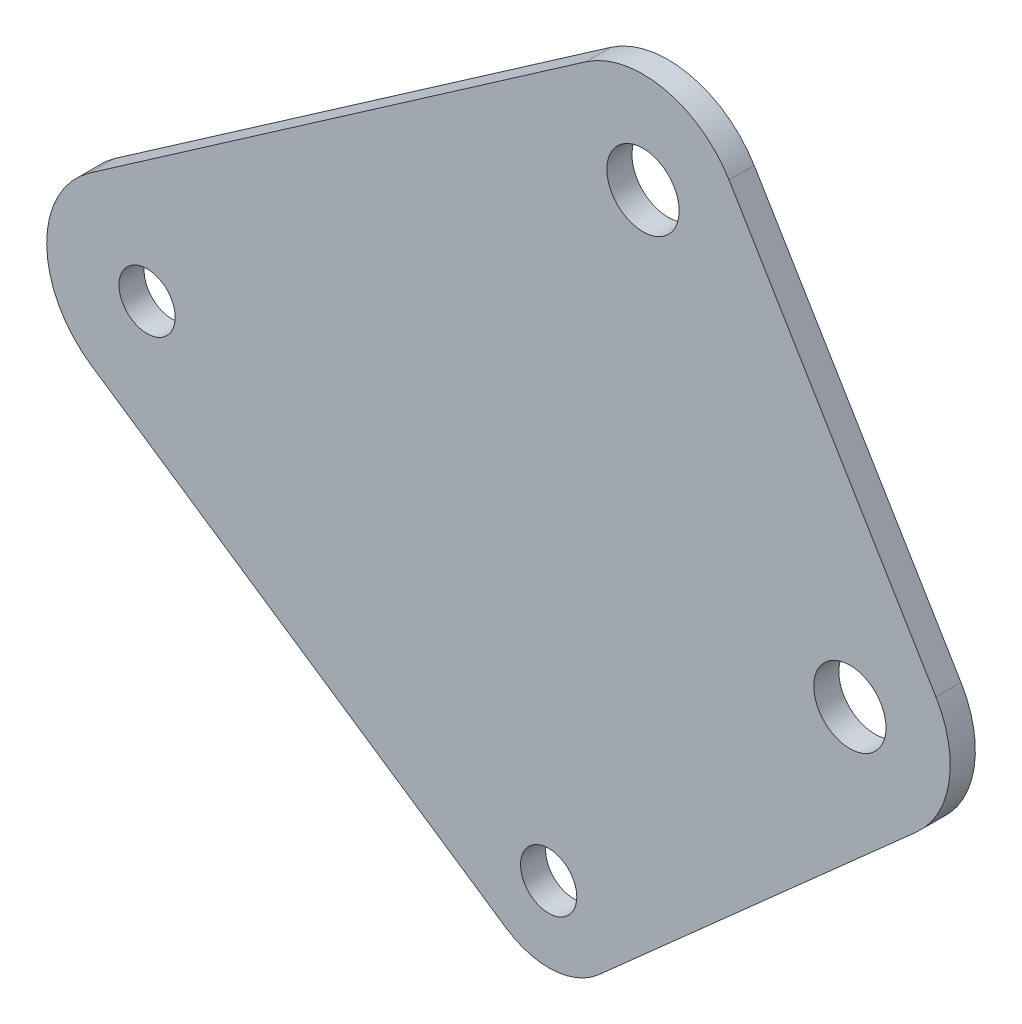
from build123d import *

# Parameters (mm, degrees)
SKETCH1_R           = 1.778
SKETCH1_R_2         = 2.286
BOSS_EXTRUDE1_DEPTH = 1.5875


with BuildPart() as part:
    # Sketch1 → Boss-Extrude1 (new body)
    with BuildSketch(Plane.XY):
        with BuildLine():
            Line((27.746244135, 26.988001148), (-3.620755523, 5.216572576))
            ThreePointArc((-3.620755523, 5.216572576), (-6.349860305, -0.042120075), (-3.55123452, -5.264146026))
            Line((-3.55123452, -5.264146026), (22.73657411, -22.99810952))
            ThreePointArc((22.73657411, -22.99810952), (25.716373542, -23.801980012), (28.563306941, -22.610181941))
            Line((28.563306941, -22.610181941), (48.667742587, -4.746909254))
            ThreePointArc((48.667742587, -4.746909254), (50.727142034, -0.959159992), (49.892857143, 3.270750086))
            Line((49.892857143, 3.270750086), (36.8098568, 25.042178657))
            ThreePointArc((36.8098568, 25.042178657), (32.699879949, 27.979965447), (27.746244135, 26.988001148))
        make_face()
        Circle(SKETCH1_R, mode=Mode.SUBTRACT)
        with Locations((44.45, 0)):
            Circle(SKETCH1_R_2, mode=Mode.SUBTRACT)
        with Locations((31.366999658, 21.771428571)):
            Circle(SKETCH1_R_2, mode=Mode.SUBTRACT)
        with Locations((25.4, -19.05)):
            Circle(SKETCH1_R, mode=Mode.SUBTRACT)
    extrude(amount=BOSS_EXTRUDE1_DEPTH)


solid = part.part
